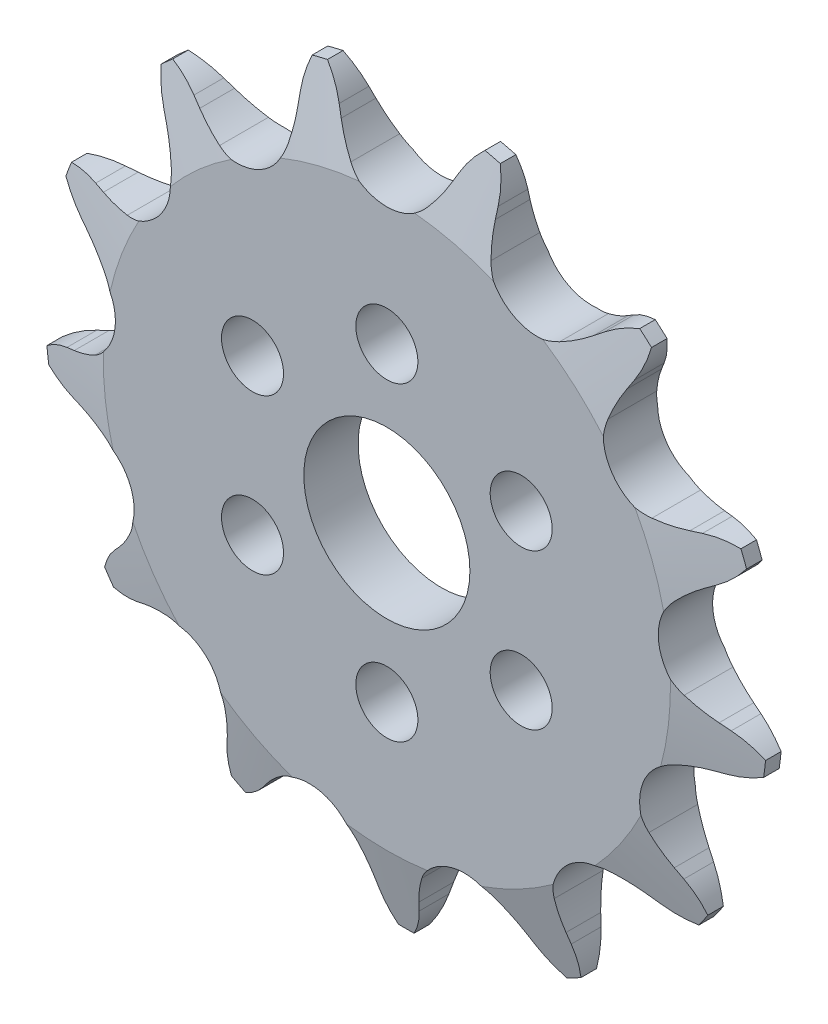
from build123d import *

# Parameters (mm, degrees)
CUT_EXTRUDE1_DEPTH      = 53.351870728
CIRPATTERN1_COUNT       = 13
CUT_EXTRUDE2_DEPTH      = 53.2238536
CUT_EXTRUDE2_DEPTH_BACK = 53.2238536
SKETCH3_OUTSIDE_W       = 96.334
SKETCH3_OUTSIDE_H       = 95.805
SKETCH3_OUTSIDE_R       = 36.957
SKETCH3_OUTSIDE_R_2     = 8.5
SKETCH4_R               = 3.175
CUT_EXTRUDE3_DEPTH      = 53.432602108


with BuildPart() as part:
    # Sketch1 → Revolve1 (revolve)
    with BuildSketch(Plane(origin=(0, 0, 0), x_dir=(0, 0, -1), z_dir=(1, 0, 0))):
        Polygon((2.778125, 0), (-2.778125, 0), (-2.778125, 29.028703417), (-0.79375, 36.966203417), (0.79375, 36.966203417), (2.778125, 29.028703417), align=None)
    revolve(axis=Axis((0, 0, -2.778125), (0, 0, 1)))

    # Sketch0 → Cut-Extrude1 (cut, symmetric)
    with BuildSketch(Plane.XY):
        with BuildLine():
            Line((13.972225644, -31.053101995), (13.299230952, -30.244466052))
            ThreePointArc((13.299230952, -30.244466052), (12.21448788, -29.08902118), (10.999745816, -28.071120349))
            ThreePointArc((10.999745816, -28.071120349), (6.706579881, -27.209664179), (3.305508878, -29.967579427))
            ThreePointArc((3.305508878, -29.967579427), (2.702950301, -31.433404637), (2.279420017, -32.960605502))
            Line((2.279420017, -32.960605502), (2.059304673, -33.989373298))
            ThreePointArc((2.059304673, -33.989373298), (-1.583510718, -39.32570906), (-7.921697375, -40.58028996))
            ThreePointArc((-7.921697375, -40.58028996), (9.894807697, -40.144812905), (25.872915747, -32.250665936))
            ThreePointArc((25.872915747, -32.250665936), (19.677697364, -34.085291927), (13.972225644, -31.053101995))
        make_face()
    cut_extrude1 = extrude(amount=CUT_EXTRUDE1_DEPTH, both=True, mode=Mode.SUBTRACT)

    # CirPattern1: Cut-Extrude1 ×13 about axis
    cirpattern1_axis = Axis((0, 0, -2.778125), (0, 0, -1))
    for i in range(1, CIRPATTERN1_COUNT):
        add(cut_extrude1.rotate(cirpattern1_axis, i * 360 / CIRPATTERN1_COUNT), mode=Mode.SUBTRACT)

    # Sketch3 outside → Cut-Extrude2 (cut, two sides: drawn at the far end of the back side and taken through both)
    # profile 1 of 2: a face of its own
    with BuildSketch(Plane.XY.offset(-CUT_EXTRUDE2_DEPTH_BACK)):
        with Locations((0, -0.4455)):
            Rectangle(SKETCH3_OUTSIDE_W, SKETCH3_OUTSIDE_H)
        Circle(SKETCH3_OUTSIDE_R, mode=Mode.SUBTRACT)
    # profile 2 of 2: a face of its own
    with BuildSketch(Plane.XY.offset(-CUT_EXTRUDE2_DEPTH_BACK)):
        Circle(SKETCH3_OUTSIDE_R_2)
    extrude(amount=CUT_EXTRUDE2_DEPTH + CUT_EXTRUDE2_DEPTH_BACK, mode=Mode.SUBTRACT)

    # Sketch4 → Cut-Extrude3 (cut, through all)
    with BuildSketch(Plane(origin=(0, 0, -2.778125), x_dir=(-1, 0, 0), z_dir=(0, 0, -1))):
        with Locations((0, 15.875)):
            Circle(SKETCH4_R)
        with Locations((13.748153285, 7.9375)):
            Circle(SKETCH4_R)
        with Locations((13.748153285, -7.9375)):
            Circle(SKETCH4_R)
        with Locations((0, -15.875)):
            Circle(SKETCH4_R)
        with Locations((-13.748153285, -7.9375)):
            Circle(SKETCH4_R)
        with Locations((-13.748153285, 7.9375)):
            Circle(SKETCH4_R)
    extrude(amount=-CUT_EXTRUDE3_DEPTH, mode=Mode.SUBTRACT)


solid = part.part
